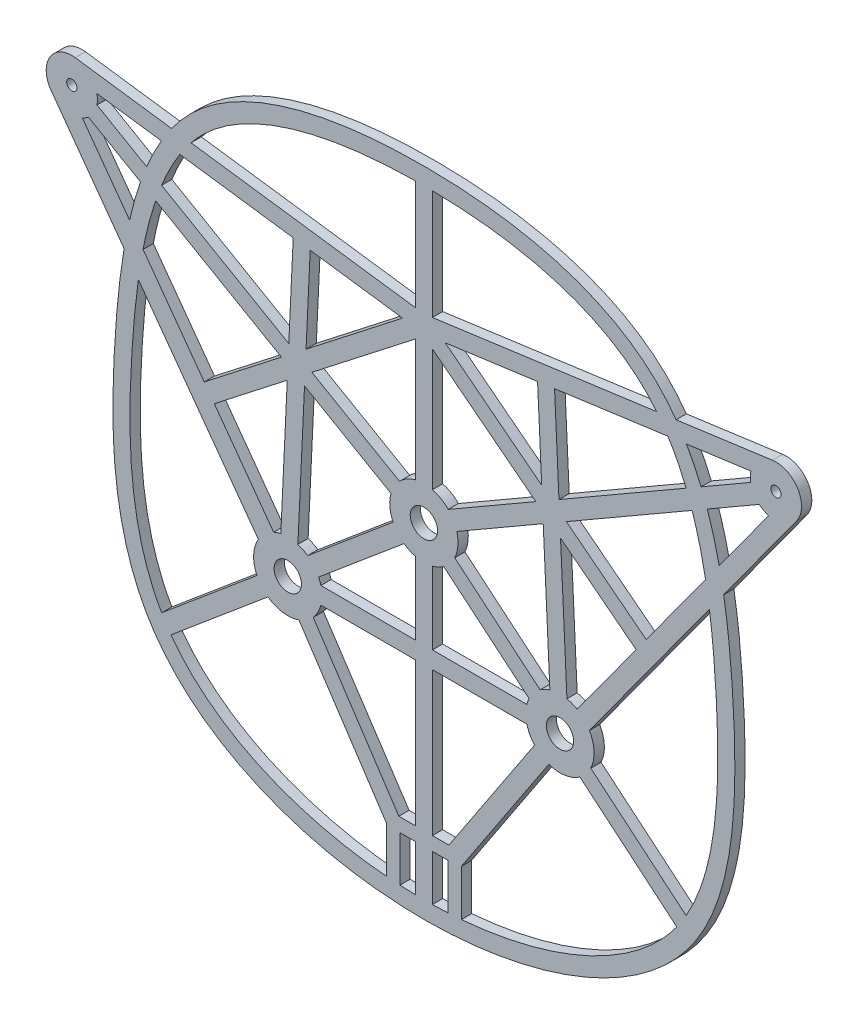
from build123d import *

# Parameters (mm, degrees)
SKETCH_1_R      = 4
SKETCH_1_R_2    = 1.5
EXTRUDE_1_DEPTH = 3
EXTRUDE_2_DEPTH = 3


# Read off the part's stored shape, not the designer's step: 凸台-拉伸2
with BuildPart() as part:
    # 草图1 → 凸台-拉伸1 (new body)
    with BuildSketch(Plane.XY):
        with BuildLine():
            Line((-2.5, 85.48347425), (-2.5, 53.341305487))
            Line((-2.5, 53.341305487), (-102.042517278, 66.931068432))
            ThreePointArc((-102.042517278, 66.931068432), (-109.493866136, 63.349292284), (-109.123538595, 55.090080597))
            Line((-109.123538595, 55.090080597), (-48.458796526, -28.363508268))
            ThreePointArc((-48.458796526, -28.363508268), (-49.825226404, -32.998798192), (-48.858473493, -37.733608865))
            Line((-48.858473493, -37.733608865), (-76.760213664, -61.145948751))
            ThreePointArc((-76.760213664, -61.145948751), (-77.505885896, -64.629749955), (-74.022084692, -65.375422188))
            Line((-74.022084692, -65.375422188), (-45.644535445, -41.56383108))
            ThreePointArc((-45.644535445, -41.56383108), (-41.268722982, -43.321544125), (-36.573936178, -42.878524117))
            Line((-36.573936178, -42.878524117), (-11, -81.507803322))
            Line((-11, -81.507803322), (-11, -95.036361883))
            ThreePointArc((-11, -95.036361883), (-9.138180782, -97.174542665), (-7, -95.312723448))
            Line((-7, -95.312723448), (-7, -82))
            Line((-7, -82), (-2.5, -82))
            Line((-2.5, -82), (-2.5, -95.476140268))
            ThreePointArc((-2.5, -95.476140268), (0, -97.976140268), (2.5, -95.476140268))
            Line((2.5, -95.476140268), (2.5, -82))
            Line((2.5, -82), (7, -82))
            Line((7, -82), (7, -95.312723448))
            ThreePointArc((7, -95.312723448), (9.138180782, -97.174542665), (11, -95.036361883))
            Line((11, -95.036361883), (11, -81.507803322))
            Line((11, -81.507803322), (36.573936178, -42.878524117))
            ThreePointArc((36.573936178, -42.878524117), (41.268722982, -43.321544125), (45.644535445, -41.56383108))
            Line((45.644535445, -41.56383108), (74.022084692, -65.375422188))
            ThreePointArc((74.022084692, -65.375422188), (77.505885896, -64.629749955), (76.760213664, -61.145948751))
            Line((76.760213664, -61.145948751), (48.858473493, -37.733608865))
            ThreePointArc((48.858473493, -37.733608865), (49.825226404, -32.998798192), (48.458796526, -28.363508268))
            Line((48.458796526, -28.363508268), (109.123538595, 55.090080597))
            ThreePointArc((109.123538595, 55.090080597), (109.493866136, 63.349292284), (102.042517278, 66.931068432))
            Line((102.042517278, 66.931068432), (2.5, 53.341305487))
            Line((2.5, 53.341305487), (2.5, 85.48347425))
            ThreePointArc((2.5, 85.48347425), (0, 86.519008156), (-2.5, 85.48347425))
        make_face()
        with BuildLine():
            ThreePointArc((-32.404793908, -40.118405872), (-31.025157709, -38.157694609), (-30.151852677, -35.924955704))
            Line((-30.151852677, -35.924955704), (-2.5, -35.924955704))
            Line((-2.5, -35.924955704), (-2.5, -78))
            Line((-2.5, -78), (-7.325851445, -78))
            Line((-7.325851445, -78), (-32.404793908, -40.118405872))
        make_face(mode=Mode.SUBTRACT)
        with Locations((-39.834311042, -33.424955704)):
            Circle(SKETCH_1_R, mode=Mode.SUBTRACT)
        with BuildLine():
            Line((-2.5, -30.924955704), (-30.151852677, -30.924955704))
            ThreePointArc((-30.151852677, -30.924955704), (-30.437384834, -30.00475427), (-30.810148591, -29.116302543))
            Line((-30.810148591, -29.116302543), (-5.810224402, -8.138875376))
            ThreePointArc((-5.810224402, -8.138875376), (-4.226182617, -9.06307787), (-2.5, -9.682458366))
            Line((-2.5, -9.682458366), (-2.5, -30.924955704))
        make_face(mode=Mode.SUBTRACT)
        with BuildLine():
            ThreePointArc((30.151852677, -35.924955704), (31.025157709, -38.157694609), (32.404793908, -40.118405872))
            Line((32.404793908, -40.118405872), (7.325851445, -78))
            Line((7.325851445, -78), (2.5, -78))
            Line((2.5, -78), (2.5, -35.924955704))
            Line((2.5, -35.924955704), (30.151852677, -35.924955704))
        make_face(mode=Mode.SUBTRACT)
        with Locations((39.834311042, -33.424955704)):
            Circle(SKETCH_1_R, mode=Mode.SUBTRACT)
        with BuildLine():
            ThreePointArc((2.5, -9.682458366), (4.226182617, -9.06307787), (5.810224402, -8.138875376))
            Line((5.810224402, -8.138875376), (30.810148591, -29.116302543))
            ThreePointArc((30.810148591, -29.116302543), (30.437384834, -30.00475427), (30.151852677, -30.924955704))
            Line((30.151852677, -30.924955704), (2.5, -30.924955704))
            Line((2.5, -30.924955704), (2.5, -9.682458366))
        make_face(mode=Mode.SUBTRACT)
        with BuildLine():
            Line((-64.282444768, 3.608597149), (-99.949505222, 52.674069079))
            ThreePointArc((-99.949505222, 52.674069079), (-99.026929927, 53.174784635), (-98.183298693, 53.799402585))
            Line((-98.183298693, 53.799402585), (-41.704391699, 21.191290428))
            Line((-41.704391699, 21.191290428), (-52.839133311, 12.520093408))
            Line((-52.839133311, 12.520093408), (-64.282444768, 3.608597149))
        make_face(mode=Mode.SUBTRACT)
        with BuildLine():
            Line((-39.992931923, 16.18679414), (-40.577629295, 3.812315834))
            Line((-40.577629295, 3.812315834), (-41.874536104, -23.635293723))
            ThreePointArc((-41.874536104, -23.635293723), (-42.945203661, -23.921148724), (-43.977668147, -24.323714475))
            Line((-43.977668147, -24.323714475), (-61.340889302, -0.437960243))
            Line((-61.340889302, -0.437960243), (-39.992931923, 16.18679414))
        make_face(mode=Mode.SUBTRACT)
        with BuildLine():
            Line((-36.880108244, -23.87128176), (-35.583201435, 3.576327797))
            Line((-35.583201435, 3.576327797), (-34.935543649, 17.283294184))
            Line((-34.935543649, 17.283294184), (-23.051718881, 10.422164756))
            Line((-23.051718881, 10.422164756), (-9.635254916, 2.676165673))
            ThreePointArc((-9.635254916, 2.676165673), (-9.961946981, -0.871557427), (-9.024162451, -4.308653161))
            Line((-9.024162451, -4.308653161), (-34.02408664, -25.286080327))
            ThreePointArc((-34.02408664, -25.286080327), (-35.395368625, -24.464163874), (-36.880108244, -23.87128176))
        make_face(mode=Mode.SUBTRACT)
        with BuildLine():
            Line((-32.773793026, 21.808709572), (-21.639051414, 30.479906592))
            Line((-21.639051414, 30.479906592), (-2.5, 45.384472085))
            Line((-2.5, 45.384472085), (-2.5, 9.682458366))
            ThreePointArc((-2.5, 9.682458366), (-5, 8.660254038), (-7.135254916, 7.006292692))
            Line((-7.135254916, 7.006292692), (-20.551718881, 14.752291774))
            Line((-20.551718881, 14.752291774), (-32.773793026, 21.808709572))
        make_face(mode=Mode.SUBTRACT)
        Polygon((-33.27173636, 52.495949818), (-6.244066259, 48.806072973), (-34.485252803, 26.81320586), align=None, mode=Mode.SUBTRACT)
        with Locations((-103.05702305, 59.5)):
            Circle(SKETCH_1_R_2, mode=Mode.SUBTRACT)
        with BuildLine():
            Line((-39.542641076, 25.716705816), (-95.683298693, 58.129529604))
            ThreePointArc((-95.683298693, 58.129529604), (-95.557412878, 59.576467433), (-95.712775953, 61.020537595))
            Line((-95.712775953, 61.020537595), (-38.245232139, 53.174942378))
            Line((-38.245232139, 53.174942378), (-39.542641076, 25.716705816))
        make_face(mode=Mode.SUBTRACT)
        Circle(SKETCH_1_R, mode=Mode.SUBTRACT)
        with BuildLine():
            ThreePointArc((9.024162451, -4.308653161), (9.961946981, -0.871557427), (9.635254916, 2.676165673))
            Line((9.635254916, 2.676165673), (34.935543649, 17.283294184))
            Line((34.935543649, 17.283294184), (36.880108244, -23.87128176))
            ThreePointArc((36.880108244, -23.87128176), (35.395368625, -24.464163874), (34.02408664, -25.286080327))
            Line((34.02408664, -25.286080327), (9.024162451, -4.308653161))
        make_face(mode=Mode.SUBTRACT)
        with BuildLine():
            Line((41.874536104, -23.635293723), (39.992931923, 16.18679414))
            Line((39.992931923, 16.18679414), (62.130300913, -1.05271574))
            Line((62.130300913, -1.05271574), (44.875861509, -24.788824111))
            ThreePointArc((44.875861509, -24.788824111), (43.421865118, -24.090639673), (41.874536104, -23.635293723))
        make_face(mode=Mode.SUBTRACT)
        with BuildLine():
            Line((2.5, 9.682458366), (2.5, 45.384472085))
            Line((2.5, 45.384472085), (32.773793026, 21.808709572))
            Line((32.773793026, 21.808709572), (7.135254916, 7.006292692))
            ThreePointArc((7.135254916, 7.006292692), (5, 8.660254038), (2.5, 9.682458366))
        make_face(mode=Mode.SUBTRACT)
        Polygon((34.485252803, 26.81320586), (6.244066259, 48.806072973), (33.27173636, 52.495949818), align=None, mode=Mode.SUBTRACT)
        with BuildLine():
            ThreePointArc((98.183298693, 53.799402585), (99.474191282, 52.911121756), (100.921483013, 52.310461159))
            Line((100.921483013, 52.310461159), (65.071856379, 2.993841653))
            Line((65.071856379, 2.993841653), (41.704391699, 21.191290428))
            Line((41.704391699, 21.191290428), (98.183298693, 53.799402585))
        make_face(mode=Mode.SUBTRACT)
        with BuildLine():
            Line((95.683298693, 58.129529604), (39.542641076, 25.716705816))
            Line((39.542641076, 25.716705816), (38.245232139, 53.174942378))
            Line((38.245232139, 53.174942378), (95.712775953, 61.020537595))
            ThreePointArc((95.712775953, 61.020537595), (95.557412878, 59.576467433), (95.683298693, 58.129529604))
        make_face(mode=Mode.SUBTRACT)
        with Locations((103.05702305, 59.5)):
            Circle(SKETCH_1_R_2, mode=Mode.SUBTRACT)
    extrude(amount=EXTRUDE_1_DEPTH)

    # 凸台-拉伸2 outline → 凸台-拉伸2 (add)
    with BuildSketch(Plane.XY):
        with BuildLine():
            add(Edge.make_bspline(
                [(68.148754529, 62.303817528), (67.697867022, 62.862168525), (65.513957323, 65.444144737), (61.1355213, 69.582634847), (52.061237376, 75.692496303), (38.534942268, 81.206712567), (20.673713762, 84.658655905), (8.294526458, 85.406461009), (2.499999984, 85.48347425)],
                knots=[0.870802839, 0.870802839, 0.870802839, 0.870802839, 0.875, 0.890625, 0.90625, 0.9375, 0.96875, 0.996072016, 0.996072016, 0.996072016, 0.996072016], degree=3))
            Line((68.148754529, 62.303817528), (73.83930715, 63.080704282))
            add(Edge.make_bspline(
                [(73.83930715, 63.080704282), (72.79600612, 64.530917632), (69.849311403, 68.234676792), (64.248460202, 73.525967604), (54.33109312, 80.189945302), (39.8914002, 86.051368753), (20.449933035, 89.792551582), (6.816644345, 90.5), (0, 90.5), (-6.816644345, 90.5), (-20.449933035, 89.792551582), (-39.8914002, 86.051368753), (-54.33109312, 80.189945302), (-64.248460202, 73.525967604), (-69.849311403, 68.234676792), (-72.79600612, 64.530917632), (-73.83930715, 63.080704282)],
                knots=[0.865560321, 0.865560321, 0.865560321, 0.865560321, 0.875, 0.890625, 0.90625, 0.9375, 0.96875, 1, 1, 1, 1.03125, 1.0625, 1.09375, 1.109375, 1.125, 1.134439679, 1.134439679, 1.134439679, 1.134439679], degree=3))
            Line((-73.83930715, 63.080704282), (-68.148754529, 62.303817528))
            add(Edge.make_bspline(
                [(-2.5, 85.48347425), (-8.294526469, 85.406461008), (-20.673713767, 84.658655904), (-38.534942268, 81.206712567), (-52.061237376, 75.692496303), (-61.1355213, 69.582634847), (-65.513957323, 65.444144737), (-67.697867022, 62.862168525), (-68.148754529, 62.303817528)],
                knots=[0.003927984, 0.003927984, 0.003927984, 0.003927984, 0.03125, 0.0625, 0.09375, 0.109375, 0.125, 0.129197161, 0.129197161, 0.129197161, 0.129197161], degree=3))
            ThreePointArc((-2.5, 85.48347425), (0, 86.519008156), (2.499999984, 85.48347425))
        make_face()
        with BuildLine():
            add(Edge.make_bspline(
                [(76.760213661, -61.145948749), (77.281182554, -60.245458802), (80.343624469, -54.560186678), (84.190760778, -42.849561014), (86.24115055, -24.696990917), (86.026105919, -8.500248512), (85.226418605, 4.690270489), (84.466098979, 13.094023348), (83.831760466, 18.137964149), (83.577029277, 19.946967598)],
                knots=[0.650231307, 0.650231307, 0.650231307, 0.650231307, 0.65625, 0.6875, 0.71875, 0.75, 0.765625, 0.78125, 0.790105277, 0.790105277, 0.790105277, 0.790105277], degree=3))
            ThreePointArc((76.760213661, -61.145948749), (77.505885896, -64.629749955), (74.022084692, -65.375422188))
            add(Edge.make_bspline(
                [(11, -95.036361884), (13.967600238, -94.785073612), (23.486527008, -93.644452643), (38.950491109, -89.927496398), (55.780102299, -82.405850807), (67.157703778, -73.757887654), (72.452980321, -67.549098789), (74.022084692, -65.375422188)],
                knots=[0.517229775, 0.517229775, 0.517229775, 0.517229775, 0.53125, 0.5625, 0.59375, 0.625, 0.640501901, 0.640501901, 0.640501901, 0.640501901], degree=3))
            ThreePointArc((11, -95.036361884), (9.138180782, -97.174542665), (7, -95.312723448))
            add(Edge.make_bspline(
                [(2.5, -95.476140268), (4.00179221, -95.447472319), (5.502464906, -95.392981062), (7, -95.312723448)],
                knots=[0.503905897, 0.503905897, 0.503905897, 0.503905897, 0.510946853, 0.510946853, 0.510946853, 0.510946853], degree=3))
            ThreePointArc((2.5, -95.476140268), (0, -97.976140268), (-2.5, -95.476140268))
            add(Edge.make_bspline(
                [(-7, -95.312723448), (-5.5024649, -95.392981063), (-4.001792198, -95.447472319), (-2.5, -95.476140268)],
                knots=[0.489053147, 0.489053147, 0.489053147, 0.489053147, 0.496094103, 0.496094103, 0.496094103, 0.496094103], degree=3))
            ThreePointArc((-7, -95.312723448), (-9.138180782, -97.174542665), (-11, -95.036361883))
            add(Edge.make_bspline(
                [(-74.022084691, -65.375422187), (-72.452980321, -67.549098789), (-67.157703778, -73.757887654), (-55.780102299, -82.405850807), (-38.950491109, -89.927496398), (-23.486527008, -93.644452643), (-13.967600238, -94.785073612), (-11, -95.036361883)],
                knots=[0.359498099, 0.359498099, 0.359498099, 0.359498099, 0.375, 0.40625, 0.4375, 0.46875, 0.482770225, 0.482770225, 0.482770225, 0.482770225], degree=3))
            ThreePointArc((-74.022084691, -65.375422187), (-77.505885896, -64.629749955), (-76.760213664, -61.145948751))
            add(Edge.make_bspline(
                [(-83.577029277, 19.946967598), (-83.831760466, 18.137964149), (-84.466098979, 13.094023348), (-85.226418605, 4.690270489), (-86.026105919, -8.500248512), (-86.24115055, -24.696990917), (-84.190760778, -42.849561014), (-80.343624467, -54.560186684), (-77.281182548, -60.245458813), (-76.760213664, -61.145948751)],
                knots=[0.209894723, 0.209894723, 0.209894723, 0.209894723, 0.21875, 0.234375, 0.25, 0.28125, 0.3125, 0.34375, 0.349768693, 0.349768693, 0.349768693, 0.349768693], degree=3))
            Line((-83.577029277, 19.946967598), (-87.745778416, 25.681716727))
            add(Edge.make_bspline(
                [(-87.745778416, 25.681716727), (-88.343132564, 22.181145005), (-89.284076924, 15.338114155), (-90.213980042, 5.052354911), (-91.023425471, -8.300155003), (-91.249087195, -24.880298028), (-89.482806537, -40.668877416), (-86.314407722, -52.443657904), (-82.915098611, -60.738657928), (-78.318474543, -68.385420625), (-70.564310164, -77.478782387), (-58.291973951, -86.778310168), (-40.530617699, -94.69988391), (-20.766532663, -99.443811458), (0, -101.028094271), (20.766532663, -99.443811458), (40.530617699, -94.69988391), (58.291973951, -86.778310168), (70.564310164, -77.478782387), (78.318474543, -68.385420625), (82.915098611, -60.738657928), (86.314407722, -52.443657904), (89.482806537, -40.668877416), (91.249087195, -24.880298028), (91.023425471, -8.300155003), (90.213980042, 5.052354911), (89.284076924, 15.338114155), (88.343132564, 22.181145005), (87.745778416, 25.681716727)],
                knots=[0.201840725, 0.201840725, 0.201840725, 0.201840725, 0.21875, 0.234375, 0.25, 0.28125, 0.3125, 0.328125, 0.34375, 0.359375, 0.375, 0.40625, 0.4375, 0.46875, 0.5, 0.53125, 0.5625, 0.59375, 0.625, 0.640625, 0.65625, 0.671875, 0.6875, 0.71875, 0.75, 0.765625, 0.78125, 0.798159275, 0.798159275, 0.798159275, 0.798159275], degree=3))
            Line((87.745778416, 25.681716727), (83.577029277, 19.946967598))
        make_face()
        with BuildLine():
            Line((76.776881476, 47.213904515), (81.148135186, 49.73764904))
            add(Edge.make_bspline(
                [(81.148135186, 49.73764904), (80.800508537, 50.576932273), (79.497266322, 53.577719353), (78.019440074, 56.448175321), (76.849059231, 58.445221604)],
                knots=[0.83911863, 0.83911863, 0.83911863, 0.83911863, 0.84375, 0.855864729, 0.855864729, 0.855864729, 0.855864729], degree=3))
            Line((76.849059231, 58.445221604), (71.444795726, 57.707419689))
            add(Edge.make_bspline(
                [(76.776881476, 47.213904515), (76.374453885, 48.210815867), (74.79299303, 51.902691846), (72.95348639, 55.340231645), (71.444795726, 57.707419689)],
                knots=[0.837925295, 0.837925295, 0.837925295, 0.837925295, 0.84375, 0.859864037, 0.859864037, 0.859864037, 0.859864037], degree=3))
        make_face()
        with BuildLine():
            Line((82.451106473, 26.901646111), (86.444561778, 32.395251897))
            add(Edge.make_bspline(
                [(86.444561778, 32.395251897), (86.294020032, 33.083430222), (85.312860796, 37.405048349), (84.12428039, 41.598651984), (82.94457807, 45.001323131)],
                knots=[0.80909414, 0.80909414, 0.80909414, 0.80909414, 0.8125, 0.830575676, 0.830575676, 0.830575676, 0.830575676], degree=3))
            Line((82.94457807, 45.001323131), (78.528663247, 42.451793519))
            add(Edge.make_bspline(
                [(82.451106473, 26.901646111), (82.050497568, 29.07033495), (80.9375283, 34.416329351), (79.512810963, 39.510812399), (78.528663247, 42.451793519)],
                knots=[0.801596863, 0.801596863, 0.801596863, 0.801596863, 0.8125, 0.82887765, 0.82887765, 0.82887765, 0.82887765], degree=3))
        make_face()
        with BuildLine():
            add(Edge.make_bspline(
                [(-78.528663247, 42.451793519), (-79.512810963, 39.510812399), (-80.81910264, 34.839794065), (-81.863318665, 29.957338972), (-82.195363397, 28.250543919)],
                knots=[0.17112235, 0.17112235, 0.17112235, 0.17112235, 0.1875, 0.196135497, 0.196135497, 0.196135497, 0.196135497], degree=3))
            Line((-78.528663247, 42.451793519), (-82.94457807, 45.001323131))
            add(Edge.make_bspline(
                [(-82.94457807, 45.001323131), (-84.12428039, 41.598651984), (-85.193861246, 37.824907993), (-86.095475402, 33.947499695), (-86.153318745, 33.695314125)],
                knots=[0.169424324, 0.169424324, 0.169424324, 0.169424324, 0.1875, 0.188755149, 0.188755149, 0.188755149, 0.188755149], degree=3))
            Line((-86.153318745, 33.695314125), (-82.195363397, 28.250543919))
        make_face()
        with BuildLine():
            add(Edge.make_bspline(
                [(-71.444795726, 57.707419689), (-72.95348639, 55.340231645), (-74.79299303, 51.902691846), (-76.374453885, 48.210815867), (-76.776881476, 47.213904515)],
                knots=[0.140135963, 0.140135963, 0.140135963, 0.140135963, 0.15625, 0.162074705, 0.162074705, 0.162074705, 0.162074705], degree=3))
            Line((-71.444795726, 57.707419689), (-76.84905924, 58.445221589))
            add(Edge.make_bspline(
                [(-76.84905924, 58.445221589), (-78.01944008, 56.448175311), (-79.497266324, 53.577719347), (-80.800508537, 50.576932273), (-81.148135186, 49.73764904)],
                knots=[0.144135271, 0.144135271, 0.144135271, 0.144135271, 0.15625, 0.16088137, 0.16088137, 0.16088137, 0.16088137], degree=3))
            Line((-81.148135186, 49.73764904), (-76.776881476, 47.213904515))
        make_face()
    extrude(amount=EXTRUDE_2_DEPTH)


solid = part.part
